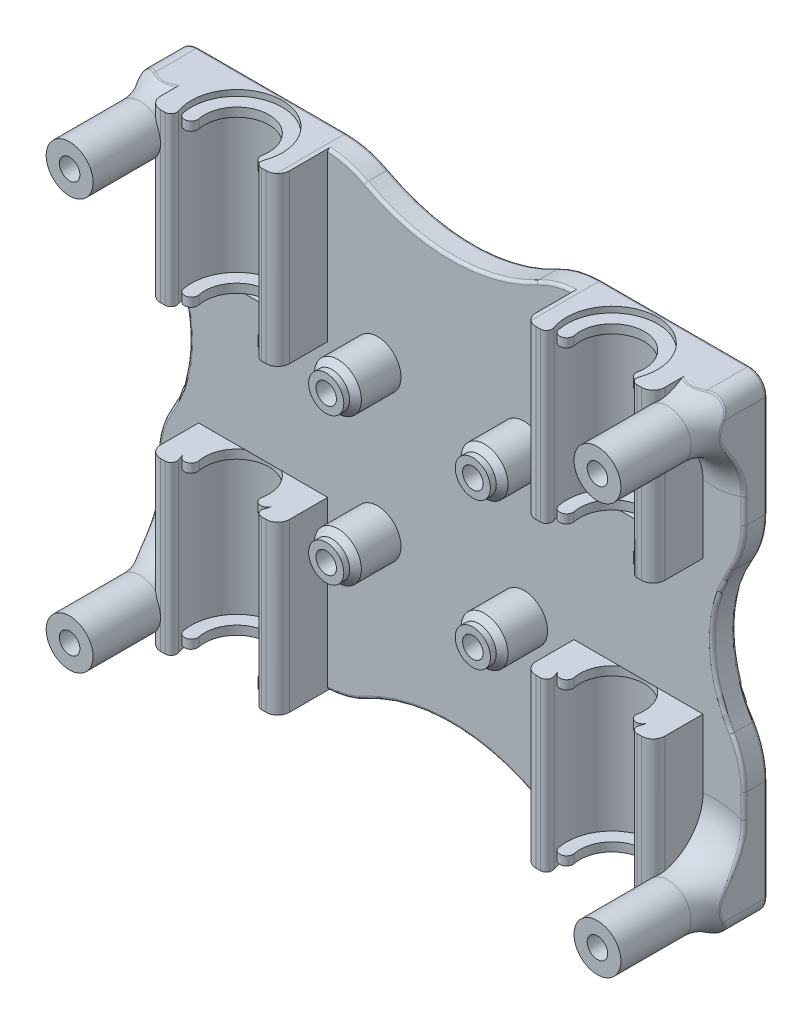
from build123d import *

# Parameters (mm, degrees)
SKETCH1_R            = 1.75
BOSS_EXTRUDE1_DEPTH  = 4
BOSS_EXTRUDE2_DEPTH  = 28.5
SKETCH3_R            = 7.75
CUT_EXTRUDE1_DEPTH   = 28.5
FILLET1_R            = 1
BOSS_EXTRUDE3_START  = -1
BOSS_EXTRUDE3_DEPTH  = 1.5
BOSS_EXTRUDE4_START  = -27
BOSS_EXTRUDE4_DEPTH  = 1.5
FILLET1_OF_MIRROR3_R = 1
MIRROR4_START        = -37.5
MIRROR4_DEPTH        = 24.5
MIRROR4_START_2      = 13
MIRROR4_2_DEPTH      = 24.5
MIRROR4_START_3      = -40
MIRROR4_3_DEPTH      = 1
MIRROR4_START_4      = 39
MIRROR4_4_DEPTH      = 1
MIRROR4_START_5      = -39
MIRROR4_5_DEPTH      = 27.5
MIRROR4_START_6      = 11.5
MIRROR4_6_DEPTH      = 27.5
MIRROR4_7_DEPTH      = 28.5
MIRROR4_8_DEPTH      = 28.5
MIRROR4_9_DEPTH      = 1.5
MIRROR4_START_7      = -13
MIRROR4_10_DEPTH     = 1.5
MIRROR4_11_DEPTH     = 1.5
MIRROR4_START_8      = 37.5
MIRROR4_12_DEPTH     = 1.5
SKETCH7_R            = 4
SKETCH7_R_2          = 1.75
BOSS_EXTRUDE5_DEPTH  = 6.75
SKETCH8_R            = 3
SKETCH8_R_2          = 1.75
BOSS_EXTRUDE6_DEPTH  = 2
CHAMFER1_SIZE        = 1
SKETCH9_R            = 4
BOSS_EXTRUDE7_DEPTH  = 20
SKETCH10_R           = 1.75
CUT_EXTRUDE2_DEPTH   = 69.381284048
FILLET2_R            = 8
FILLET3_R            = 15
FILLET4_R            = 0.5
SKETCH11_R           = 2.1
CUT_EXTRUDE3_DEPTH   = 4
CHAMFER2_SIZE        = 0.5


# Read off the part's stored shape, not the designer's step: Mirror4
# Some blends are built 0.0001 mm under size
with BuildPart() as part:
    # Sketch1 → Boss-Extrude1 (new body)
    with BuildSketch(Plane.XY):
        with BuildLine():
            Line((-47, 40), (-17.5, 40))
            ThreePointArc((-17.5, 40), (0, 34.483610961), (17.5, 40))
            Line((17.5, 40), (47, 40))
            ThreePointArc((47, 40), (49.121320344, 39.121320344), (50, 37))
            Line((50, 37), (50, 15))
            ThreePointArc((50, 15), (44.569250972, 0), (50, -15))
            Line((50, -15), (50, -37))
            ThreePointArc((50, -37), (49.121320344, -39.121320344), (47, -40))
            Line((47, -40), (17.5, -40))
            ThreePointArc((17.5, -40), (0, -34.483610961), (-17.5, -40))
            Line((-17.5, -40), (-47, -40))
            ThreePointArc((-47, -40), (-49.121320344, -39.121320344), (-50, -37))
            Line((-50, -37), (-50, -15))
            ThreePointArc((-50, -15), (-44.569250972, 0), (-50, 15))
            Line((-50, 15), (-50, 37))
            ThreePointArc((-50, 37), (-49.121320344, 39.121320344), (-47, 40))
        make_face()
        with Locations((-12.5, 12.5)):
            Circle(SKETCH1_R, mode=Mode.SUBTRACT)
        with Locations((12.5, 12.5)):
            Circle(SKETCH1_R, mode=Mode.SUBTRACT)
        with Locations((-12.5, -12.5)):
            Circle(SKETCH1_R, mode=Mode.SUBTRACT)
        with Locations((12.5, -12.5)):
            Circle(SKETCH1_R, mode=Mode.SUBTRACT)
    extrude(amount=BOSS_EXTRUDE1_DEPTH)

    # Sketch2 → Boss-Extrude2 (add)
    with BuildSketch(Plane.XZ.offset(40)):
        with BuildLine():
            Line((-43, 4), (-43, 10.5))
            ThreePointArc((-43, 10.5), (-42.414213562, 11.914213562), (-41, 12.5))
            Line((-41, 12.5), (-23, 12.5))
            ThreePointArc((-23, 12.5), (-21.585786438, 11.914213562), (-21, 10.5))
            Line((-21, 10.5), (-21, 4))
            Line((-21, 4), (-43, 4))
        make_face()
    boss_extrude2 = extrude(amount=-BOSS_EXTRUDE2_DEPTH)

    # Sketch3 → Cut-Extrude1 (cut)
    with BuildSketch(Plane.XZ.offset(40)):
        with Locations((-32, 8.5)):
            Circle(SKETCH3_R)
    cut_extrude1 = extrude(amount=-CUT_EXTRUDE1_DEPTH, mode=Mode.SUBTRACT)

    # Fillet1
    fillet1_edges = [part.edges().sort_by_distance(p)[0] for p in [
        (-38.637959024, -25.75, 12.5),
        (-25.362040976, -25.75, 12.5),
    ]]
    fillet(fillet1_edges, radius=FILLET1_R)

    # Sketch4 → Boss-Extrude3 (add)
    with BuildSketch(Plane.XZ.offset(40).offset(BOSS_EXTRUDE3_START)):
        with BuildLine():
            ThreePointArc((-39.603453163, 10), (-32, 0.75), (-24.396546837, 10))
            ThreePointArc((-24.396546837, 10), (-25.718015845, 10.885985137), (-26.604000981, 9.564516129))
            ThreePointArc((-26.604000981, 9.564516129), (-32, 3), (-37.395999019, 9.564516129))
            ThreePointArc((-37.395999019, 9.564516129), (-38.281984155, 10.885985137), (-39.603453163, 10))
        make_face()
    boss_extrude3 = extrude(amount=-BOSS_EXTRUDE3_DEPTH)

    # Sketch5 → Boss-Extrude4 (add)
    with BuildSketch(Plane.XZ.offset(40).offset(BOSS_EXTRUDE4_START)):
        with BuildLine():
            ThreePointArc((-24.396546837, 10), (-25.718015845, 10.885985137), (-26.604000981, 9.564516129))
            ThreePointArc((-26.604000981, 9.564516129), (-32, 3), (-37.395999019, 9.564516129))
            ThreePointArc((-37.395999019, 9.564516129), (-38.281984155, 10.885985137), (-39.603453163, 10))
            ThreePointArc((-39.603453163, 10), (-32, 0.75), (-24.396546837, 10))
        make_face()
    boss_extrude4 = extrude(amount=-BOSS_EXTRUDE4_DEPTH)

    # Mirror3: Boss-Extrude2, Cut-Extrude1, Boss-Extrude3, Boss-Extrude4 across plane
    add(boss_extrude2.mirror(Plane.ZX))
    add(cut_extrude1.mirror(Plane.ZX), mode=Mode.SUBTRACT)
    add(boss_extrude3.mirror(Plane.ZX))
    add(boss_extrude4.mirror(Plane.ZX))

    # Fillet1 of Mirror3
    fillet1_of_mirror3_edges = [part.edges().sort_by_distance(p)[0] for p in [
        (-38.637959024, 25.75, 12.5),
        (-25.362040976, 25.75, 12.5),
    ]]
    fillet(fillet1_of_mirror3_edges, radius=FILLET1_OF_MIRROR3_R)

    # Mirror4 outline → Mirror4 (cut)
    with BuildSketch(Plane(origin=(0, 0, 0), x_dir=(1, 0, 0), z_dir=(0, 1, 0)).offset(MIRROR4_START)):
        with BuildLine():
            ThreePointArc((38.309714732, -4), (32, -0.75), (25.690285268, -4))
            Line((25.690285268, -4), (38.309714732, -4))
        make_face()
    extrude(amount=MIRROR4_DEPTH, mode=Mode.SUBTRACT)

    # Mirror4 2 outline → Mirror4 2 (cut)
    with BuildSketch(Plane(origin=(0, 0, 0), x_dir=(1, 0, 0), z_dir=(0, 1, 0)).offset(MIRROR4_START_2)):
        with BuildLine():
            ThreePointArc((38.309714732, -4), (32, -0.75), (25.690285268, -4))
            Line((25.690285268, -4), (38.309714732, -4))
        make_face()
    extrude(amount=MIRROR4_2_DEPTH, mode=Mode.SUBTRACT)

    # Mirror4 3 outline → Mirror4 3 (cut)
    with BuildSketch(Plane(origin=(0, 0, 0), x_dir=(1, 0, 0), z_dir=(0, 1, 0)).offset(MIRROR4_START_3)):
        with BuildLine():
            ThreePointArc((38.309714732, -4), (32, -0.75), (25.690285268, -4))
            Line((25.690285268, -4), (38.309714732, -4))
        make_face()
    extrude(amount=MIRROR4_3_DEPTH, mode=Mode.SUBTRACT)

    # Mirror4 4 outline → Mirror4 4 (cut)
    with BuildSketch(Plane(origin=(0, 0, 0), x_dir=(1, 0, 0), z_dir=(0, 1, 0)).offset(MIRROR4_START_4)):
        with BuildLine():
            ThreePointArc((38.309714732, -4), (32, -0.75), (25.690285268, -4))
            Line((25.690285268, -4), (38.309714732, -4))
        make_face()
    extrude(amount=MIRROR4_4_DEPTH, mode=Mode.SUBTRACT)

    # Mirror4 5 outline → Mirror4 5 (cut)
    with BuildSketch(Plane(origin=(0, 0, 0), x_dir=(1, 0, 0), z_dir=(0, 1, 0)).offset(MIRROR4_START_5)):
        with BuildLine():
            Line((28.83772234, -4), (35.16227766, -4))
            ThreePointArc((35.16227766, -4), (32, -3), (28.83772234, -4))
        make_face()
    extrude(amount=MIRROR4_5_DEPTH, mode=Mode.SUBTRACT)

    # Mirror4 6 outline → Mirror4 6 (cut)
    with BuildSketch(Plane(origin=(0, 0, 0), x_dir=(1, 0, 0), z_dir=(0, 1, 0)).offset(MIRROR4_START_6)):
        with BuildLine():
            Line((28.83772234, -4), (35.16227766, -4))
            ThreePointArc((35.16227766, -4), (32, -3), (28.83772234, -4))
        make_face()
    extrude(amount=MIRROR4_6_DEPTH, mode=Mode.SUBTRACT)

    # Mirror4 7 outline → Mirror4 7 (add)
    with BuildSketch(Plane(origin=(0, 0, 0), x_dir=(1, 0, 0), z_dir=(0, 1, 0)).offset(MIRROR4_START_3)):
        with BuildLine():
            ThreePointArc((38.309714732, -4), (39.679712429, -7.458598533), (39.280253556, -11.157142857))
            ThreePointArc((39.280253556, -11.157142857), (39.40023366, -12.073211504), (40.219641111, -12.5))
            Line((40.219641111, -12.5), (41, -12.5))
            ThreePointArc((41, -12.5), (42.414213562, -11.914213562), (43, -10.5))
            Line((43, -10.5), (43, -4))
            Line((43, -4), (38.309714732, -4))
        make_face()
        with BuildLine():
            ThreePointArc((24.719746444, -11.157142857), (24.320287571, -7.458598533), (25.690285268, -4))
            Line((25.690285268, -4), (21, -4))
            Line((21, -4), (21, -10.5))
            ThreePointArc((21, -10.5), (21.585786438, -11.914213562), (23, -12.5))
            Line((23, -12.5), (23.780358889, -12.5))
            ThreePointArc((23.780358889, -12.5), (24.59976634, -12.073211504), (24.719746444, -11.157142857))
        make_face()
    extrude(amount=MIRROR4_7_DEPTH)

    # Mirror4 8 outline → Mirror4 8 (add)
    with BuildSketch(Plane(origin=(0, 0, 0), x_dir=(1, 0, 0), z_dir=(0, 1, 0)).offset(MIRROR4_START_6)):
        with BuildLine():
            ThreePointArc((38.309714732, -4), (39.679712429, -7.458598533), (39.280253556, -11.157142857))
            ThreePointArc((39.280253556, -11.157142857), (39.40023366, -12.073211504), (40.219641111, -12.5))
            Line((40.219641111, -12.5), (41, -12.5))
            ThreePointArc((41, -12.5), (42.414213562, -11.914213562), (43, -10.5))
            Line((43, -10.5), (43, -4))
            Line((43, -4), (38.309714732, -4))
        make_face()
        with BuildLine():
            ThreePointArc((24.719746444, -11.157142857), (24.320287571, -7.458598533), (25.690285268, -4))
            Line((25.690285268, -4), (21, -4))
            Line((21, -4), (21, -10.5))
            ThreePointArc((21, -10.5), (21.585786438, -11.914213562), (23, -12.5))
            Line((23, -12.5), (23.780358889, -12.5))
            ThreePointArc((23.780358889, -12.5), (24.59976634, -12.073211504), (24.719746444, -11.157142857))
        make_face()
    extrude(amount=MIRROR4_8_DEPTH)

    # Mirror4 9 outline → Mirror4 9 (add)
    with BuildSketch(Plane(origin=(0, 0, 0), x_dir=(1, 0, 0), z_dir=(0, 1, 0)).offset(MIRROR4_START_5)):
        with BuildLine():
            ThreePointArc((37.395999019, -9.564516129), (38.281984155, -10.885985137), (39.603453163, -10))
            ThreePointArc((39.603453163, -10), (39.575886761, -6.866464025), (38.309714732, -4))
            Line((38.309714732, -4), (35.16227766, -4))
            ThreePointArc((35.16227766, -4), (37.104114504, -6.451094162), (37.395999019, -9.564516129))
        make_face()
        with BuildLine():
            Line((28.83772234, -4), (25.690285268, -4))
            ThreePointArc((25.690285268, -4), (24.424113239, -6.866464025), (24.396546837, -10))
            ThreePointArc((24.396546837, -10), (25.718015845, -10.885985137), (26.604000981, -9.564516129))
            ThreePointArc((26.604000981, -9.564516129), (26.895885496, -6.451094162), (28.83772234, -4))
        make_face()
    extrude(amount=MIRROR4_9_DEPTH)

    # Mirror4 10 outline → Mirror4 10 (add)
    with BuildSketch(Plane(origin=(0, 0, 0), x_dir=(1, 0, 0), z_dir=(0, 1, 0)).offset(MIRROR4_START_7)):
        with BuildLine():
            ThreePointArc((37.395999019, -9.564516129), (38.281984155, -10.885985137), (39.603453163, -10))
            ThreePointArc((39.603453163, -10), (39.575886761, -6.866464025), (38.309714732, -4))
            Line((38.309714732, -4), (35.16227766, -4))
            ThreePointArc((35.16227766, -4), (37.104114504, -6.451094162), (37.395999019, -9.564516129))
        make_face()
        with BuildLine():
            Line((28.83772234, -4), (25.690285268, -4))
            ThreePointArc((25.690285268, -4), (24.424113239, -6.866464025), (24.396546837, -10))
            ThreePointArc((24.396546837, -10), (25.718015845, -10.885985137), (26.604000981, -9.564516129))
            ThreePointArc((26.604000981, -9.564516129), (26.895885496, -6.451094162), (28.83772234, -4))
        make_face()
    extrude(amount=MIRROR4_10_DEPTH)

    # Mirror4 11 outline → Mirror4 11 (add)
    with BuildSketch(Plane(origin=(0, 0, 0), x_dir=(1, 0, 0), z_dir=(0, 1, 0)).offset(MIRROR4_START_6)):
        with BuildLine():
            ThreePointArc((37.395999019, -9.564516129), (38.281984155, -10.885985137), (39.603453163, -10))
            ThreePointArc((39.603453163, -10), (39.575886761, -6.866464025), (38.309714732, -4))
            Line((38.309714732, -4), (35.16227766, -4))
            ThreePointArc((35.16227766, -4), (37.104114504, -6.451094162), (37.395999019, -9.564516129))
        make_face()
        with BuildLine():
            Line((28.83772234, -4), (25.690285268, -4))
            ThreePointArc((25.690285268, -4), (24.424113239, -6.866464025), (24.396546837, -10))
            ThreePointArc((24.396546837, -10), (25.718015845, -10.885985137), (26.604000981, -9.564516129))
            ThreePointArc((26.604000981, -9.564516129), (26.895885496, -6.451094162), (28.83772234, -4))
        make_face()
    extrude(amount=MIRROR4_11_DEPTH)

    # Mirror4 12 outline → Mirror4 12 (add)
    with BuildSketch(Plane(origin=(0, 0, 0), x_dir=(1, 0, 0), z_dir=(0, 1, 0)).offset(MIRROR4_START_8)):
        with BuildLine():
            ThreePointArc((37.395999019, -9.564516129), (38.281984155, -10.885985137), (39.603453163, -10))
            ThreePointArc((39.603453163, -10), (39.575886761, -6.866464025), (38.309714732, -4))
            Line((38.309714732, -4), (35.16227766, -4))
            ThreePointArc((35.16227766, -4), (37.104114504, -6.451094162), (37.395999019, -9.564516129))
        make_face()
        with BuildLine():
            Line((28.83772234, -4), (25.690285268, -4))
            ThreePointArc((25.690285268, -4), (24.424113239, -6.866464025), (24.396546837, -10))
            ThreePointArc((24.396546837, -10), (25.718015845, -10.885985137), (26.604000981, -9.564516129))
            ThreePointArc((26.604000981, -9.564516129), (26.895885496, -6.451094162), (28.83772234, -4))
        make_face()
    extrude(amount=MIRROR4_12_DEPTH)

    # Sketch7 → Boss-Extrude5 (add)
    # profile 1 of 4: a face of its own
    with BuildSketch(Plane.XY.offset(4)):
        with Locations((-12.5, 12.5)):
            Circle(SKETCH7_R)
        with Locations((-12.5, 12.5)):
            Circle(SKETCH7_R_2, mode=Mode.SUBTRACT)
    # profile 2 of 4: a face of its own
    with BuildSketch(Plane.XY.offset(4)):
        with Locations((12.5, 12.5)):
            Circle(SKETCH7_R)
        with Locations((12.5, 12.5)):
            Circle(SKETCH7_R_2, mode=Mode.SUBTRACT)
    # profile 3 of 4: a face of its own
    with BuildSketch(Plane.XY.offset(4)):
        with Locations((12.5, -12.5)):
            Circle(SKETCH7_R)
        with Locations((12.5, -12.5)):
            Circle(SKETCH7_R_2, mode=Mode.SUBTRACT)
    # profile 4 of 4: a face of its own
    with BuildSketch(Plane.XY.offset(4)):
        with Locations((-12.5, -12.5)):
            Circle(SKETCH7_R)
        with Locations((-12.5, -12.5)):
            Circle(SKETCH7_R_2, mode=Mode.SUBTRACT)
    extrude(amount=BOSS_EXTRUDE5_DEPTH)

    # Sketch8 → Boss-Extrude6 (add)
    # profile 1 of 4: a face of its own
    with BuildSketch(Plane.XY.offset(10.75)):
        with Locations((-12.5, 12.5)):
            Circle(SKETCH8_R)
        with Locations((-12.5, 12.5)):
            Circle(SKETCH8_R_2, mode=Mode.SUBTRACT)
    # profile 2 of 4: a face of its own
    with BuildSketch(Plane.XY.offset(10.75)):
        with Locations((12.5, 12.5)):
            Circle(SKETCH8_R)
        with Locations((12.5, 12.5)):
            Circle(SKETCH8_R_2, mode=Mode.SUBTRACT)
    # profile 3 of 4: a face of its own
    with BuildSketch(Plane.XY.offset(10.75)):
        with Locations((12.5, -12.5)):
            Circle(SKETCH8_R)
        with Locations((12.5, -12.5)):
            Circle(SKETCH8_R_2, mode=Mode.SUBTRACT)
    # profile 4 of 4: a face of its own
    with BuildSketch(Plane.XY.offset(10.75)):
        with Locations((-12.5, -12.5)):
            Circle(SKETCH8_R)
        with Locations((-12.5, -12.5)):
            Circle(SKETCH8_R_2, mode=Mode.SUBTRACT)
    extrude(amount=BOSS_EXTRUDE6_DEPTH)

    # Chamfer1
    chamfer1_edges = [part.edges().sort_by_distance(p)[0] for p in [
        (-15.5, 12.5, 10.75),
        (9.5, 12.5, 10.75),
        (9.5, -12.5, 10.75),
        (-15.5, -12.5, 10.75),
    ]]
    chamfer(chamfer1_edges, length=CHAMFER1_SIZE - 0.0001)  # a hair under: the kernel refuses the full size

    # Sketch9 → Boss-Extrude7 (add)
    with BuildSketch(Plane.XY.offset(4)):
        with Locations((-45, 35)):
            Circle(SKETCH9_R)
        with Locations(Location((45, 35, 0), (0, 0, 180))):
            Circle(SKETCH9_R)
        with Locations(Location((45, -35, 0), (0, 0, 180))):
            Circle(SKETCH9_R)
        with Locations((-45, -35)):
            Circle(SKETCH9_R)
    extrude(amount=BOSS_EXTRUDE7_DEPTH)

    # Sketch10 → Cut-Extrude2 (cut, through all)
    with BuildSketch(Plane.XY.offset(24)):
        with Locations((45, 35)):
            Circle(SKETCH10_R)
        with Locations((45, -35)):
            Circle(SKETCH10_R)
        with Locations((-45, -35)):
            Circle(SKETCH10_R)
        with Locations((-45, 35)):
            Circle(SKETCH10_R)
    extrude(amount=-CUT_EXTRUDE2_DEPTH, mode=Mode.SUBTRACT)

    # Fillet2
    fillet2_edges = [part.edges().sort_by_distance(p)[0] for p in [
        (-49, 35, 4),
        (-49, -35, 4),
        (49, -35, 4),
        (49, 35, 4),
    ]]
    fillet(fillet2_edges, radius=FILLET2_R)

    # Fillet3
    fillet3_edges = [part.edges().sort_by_distance(p)[0] for p in [
        (50, -15, 2),
        (50, 15, 2),
        (17.5, 40, 2),
        (-17.5, 40, 2),
        (-50, 15, 2),
        (-50, -15, 2),
        (-17.5, -40, 2),
        (17.5, -40, 2),
    ]]
    fillet(fillet3_edges, radius=FILLET3_R)

    # Fillet4
    fillet4_edges = [part.edges().sort_by_distance(p)[0] for p in [
        (45.000000002, -40, 8.127016654),
        (49.121320342, -39.121320344, 6.909647533),
        (50, -30.659236484, 6.077999903),
        (50, -21.893517709, 4),
        (49.460371109, -15.708559627, 4),
        (44.999999998, 40, 8.127016654),
        (49.121320344, 39.121320342, 6.909647533),
        (50, 30.659236485, 6.0779999),
        (50, 21.893517709, 4),
        (49.460371109, 15.708559627, 4),
        (17.679348167, 39.445630646, 4),
        (-17.679348167, 39.445630646, 4),
        (-45.000000002, 40, 8.127016654),
        (-49.121320342, 39.121320344, 6.909647533),
        (-50, 30.659236484, 6.077999903),
        (-50, 21.893517709, 4),
        (-49.460371109, 15.708559627, 4),
        (-44.999999998, -40, 8.127016654),
        (-49.121320344, -39.121320342, 6.909647533),
        (-50, -30.659236485, 6.0779999),
        (-50, -21.893517709, 4),
        (-49.460371109, -15.708559627, 4),
        (-17.679348167, -39.445630646, 4),
        (17.679348167, -39.445630646, 4),
        (49.460371109, 15.708559627, 0),
        (50, 28.347873766, 0),
        (49.121320344, 39.121320344, 0),
        (34.359807447, 40, 0),
        (18.027120844, 39.538414208, 0),
        (0, 34.483610961, 0),
        (-18.027120844, 39.538414208, 0),
        (-34.359807447, 40, 0),
        (-49.121320344, 39.121320344, 0),
        (-50, 28.347873766, 0),
        (-49.460371109, 15.708559627, 0),
        (-44.569250972, 0, 0),
        (-49.460371109, -15.708559627, 0),
        (-50, -28.347873766, 0),
        (-49.121320344, -39.121320344, 0),
        (-34.359807447, -40, 0),
        (-18.027120844, -39.538414208, 0),
        (0, -34.483610961, 0),
        (18.027120844, -39.538414208, 0),
        (34.359807447, -40, 0),
        (49.121320344, -39.121320344, 0),
        (50, -28.347873766, 0),
        (49.460371109, -15.708559627, 0),
        (44.569250972, 0, 0),
        (44.569250972, 0, 4),
        (0, 34.483610961, 4),
        (-44.569250972, 0, 4),
        (0, -34.483610961, 4),
    ]]
    fillet(fillet4_edges, radius=FILLET4_R)

    # Sketch11 → Cut-Extrude3 (cut)
    with BuildSketch(Plane(origin=(0, 0, 0), x_dir=(-1, 0, 0), z_dir=(0, 0, -1))):
        with Locations((-45, 35)):
            Circle(SKETCH11_R)
        with Locations((-12.5, 12.5)):
            Circle(SKETCH11_R)
        with Locations((12.5, 12.5)):
            Circle(SKETCH11_R)
        with Locations((12.5, -12.5)):
            Circle(SKETCH11_R)
        with Locations((-12.5, -12.5)):
            Circle(SKETCH11_R)
        with Locations((-45, -35)):
            Circle(SKETCH11_R)
        with Locations((45, 35)):
            Circle(SKETCH11_R)
        with Locations((45, -35)):
            Circle(SKETCH11_R)
    extrude(amount=-CUT_EXTRUDE3_DEPTH, mode=Mode.SUBTRACT)

    # Chamfer2
    # the kernel refuses this chamfer: 0.5 mm, written as the material it takes off along each edge
    with BuildSketch(Plane(origin=(12.5, 12.5, 4), x_dir=(1, 0, 0), z_dir=(0, 1, 0))) as chamfer2_piece_1_section:
        Polygon((1.75 + CHAMFER2_SIZE, 0), (1.75, -CHAMFER2_SIZE), (1.75, 0), align=None)
    chamfer2_piece_1 = revolve(axis=Axis((12.5, 12.5, 4), (0, 0, -1)), mode=Mode.PRIVATE)
    chamfer2_piece_1 = chamfer2_piece_1 & Plane(origin=(12.5, 12.5, 4.324043687), x_dir=(-1, 0, 0), z_dir=(0, 0, -1)) * Cylinder(2.1, 9, mode=Mode.PRIVATE)
    add(chamfer2_piece_1, mode=Mode.SUBTRACT)
    with BuildSketch(Plane(origin=(-12.5, 12.5, 4), x_dir=(1, 0, 0), z_dir=(0, 1, 0))) as chamfer2_piece_2_section:
        Polygon((1.75 + CHAMFER2_SIZE, 0), (1.75, -CHAMFER2_SIZE), (1.75, 0), align=None)
    chamfer2_piece_2 = revolve(axis=Axis((-12.5, 12.5, 4), (0, 0, -1)), mode=Mode.PRIVATE)
    chamfer2_piece_2 = chamfer2_piece_2 & Plane(origin=(-12.5, 12.5, 4.324043687), x_dir=(-1, 0, 0), z_dir=(0, 0, -1)) * Cylinder(2.1, 9, mode=Mode.PRIVATE)
    add(chamfer2_piece_2, mode=Mode.SUBTRACT)
    with BuildSketch(Plane(origin=(-12.5, -12.5, 4), x_dir=(1, 0, 0), z_dir=(0, 1, 0))) as chamfer2_piece_3_section:
        Polygon((1.75 + CHAMFER2_SIZE, 0), (1.75, -CHAMFER2_SIZE), (1.75, 0), align=None)
    chamfer2_piece_3 = revolve(axis=Axis((-12.5, -12.5, 4), (0, 0, -1)), mode=Mode.PRIVATE)
    chamfer2_piece_3 = chamfer2_piece_3 & Plane(origin=(-12.5, -12.5, 4.324043687), x_dir=(-1, 0, 0), z_dir=(0, 0, -1)) * Cylinder(2.1, 9, mode=Mode.PRIVATE)
    add(chamfer2_piece_3, mode=Mode.SUBTRACT)
    with BuildSketch(Plane(origin=(12.5, -12.5, 4), x_dir=(1, 0, 0), z_dir=(0, 1, 0))) as chamfer2_piece_4_section:
        Polygon((1.75 + CHAMFER2_SIZE, 0), (1.75, -CHAMFER2_SIZE), (1.75, 0), align=None)
    chamfer2_piece_4 = revolve(axis=Axis((12.5, -12.5, 4), (0, 0, -1)), mode=Mode.PRIVATE)
    chamfer2_piece_4 = chamfer2_piece_4 & Plane(origin=(12.5, -12.5, 4.324043687), x_dir=(-1, 0, 0), z_dir=(0, 0, -1)) * Cylinder(2.1, 9, mode=Mode.PRIVATE)
    add(chamfer2_piece_4, mode=Mode.SUBTRACT)
    with BuildSketch(Plane(origin=(45, -35, 4), x_dir=(1, 0, 0), z_dir=(0, -1, 0))) as chamfer2_piece_5_section:
        Polygon((1.75, CHAMFER2_SIZE), (1.75 + CHAMFER2_SIZE, 0), (1.75, 0), align=None)
    chamfer2_piece_5 = revolve(axis=Axis((45, -35, 4), (0, 0, 1)), mode=Mode.PRIVATE)
    chamfer2_piece_5 = chamfer2_piece_5 & Plane(origin=(45, -35, 4.324043687), x_dir=(-1, 0, 0), z_dir=(0, 0, -1)) * Cylinder(2.1, 10, mode=Mode.PRIVATE)
    add(chamfer2_piece_5, mode=Mode.SUBTRACT)
    with BuildSketch(Plane(origin=(-45, -35, 4), x_dir=(1, 0, 0), z_dir=(0, -1, 0))) as chamfer2_piece_6_section:
        Polygon((1.75, CHAMFER2_SIZE), (1.75 + CHAMFER2_SIZE, 0), (1.75, 0), align=None)
    chamfer2_piece_6 = revolve(axis=Axis((-45, -35, 4), (0, 0, 1)), mode=Mode.PRIVATE)
    chamfer2_piece_6 = chamfer2_piece_6 & Plane(origin=(-45, -35, 4.324043687), x_dir=(-1, 0, 0), z_dir=(0, 0, -1)) * Cylinder(2.1, 10, mode=Mode.PRIVATE)
    add(chamfer2_piece_6, mode=Mode.SUBTRACT)
    with BuildSketch(Plane(origin=(-45, 35, 4), x_dir=(1, 0, 0), z_dir=(0, -1, 0))) as chamfer2_piece_7_section:
        Polygon((1.75, CHAMFER2_SIZE), (1.75 + CHAMFER2_SIZE, 0), (1.75, 0), align=None)
    chamfer2_piece_7 = revolve(axis=Axis((-45, 35, 4), (0, 0, 1)), mode=Mode.PRIVATE)
    chamfer2_piece_7 = chamfer2_piece_7 & Plane(origin=(-45, 35, 4.324043687), x_dir=(-1, 0, 0), z_dir=(0, 0, -1)) * Cylinder(2.1, 10, mode=Mode.PRIVATE)
    add(chamfer2_piece_7, mode=Mode.SUBTRACT)
    with BuildSketch(Plane(origin=(45, 35, 4), x_dir=(1, 0, 0), z_dir=(0, -1, 0))) as chamfer2_piece_8_section:
        Polygon((1.75, CHAMFER2_SIZE), (1.75 + CHAMFER2_SIZE, 0), (1.75, 0), align=None)
    chamfer2_piece_8 = revolve(axis=Axis((45, 35, 4), (0, 0, 1)), mode=Mode.PRIVATE)
    chamfer2_piece_8 = chamfer2_piece_8 & Plane(origin=(45, 35, 4.324043687), x_dir=(-1, 0, 0), z_dir=(0, 0, -1)) * Cylinder(2.1, 10, mode=Mode.PRIVATE)
    add(chamfer2_piece_8, mode=Mode.SUBTRACT)


solid = part.part
